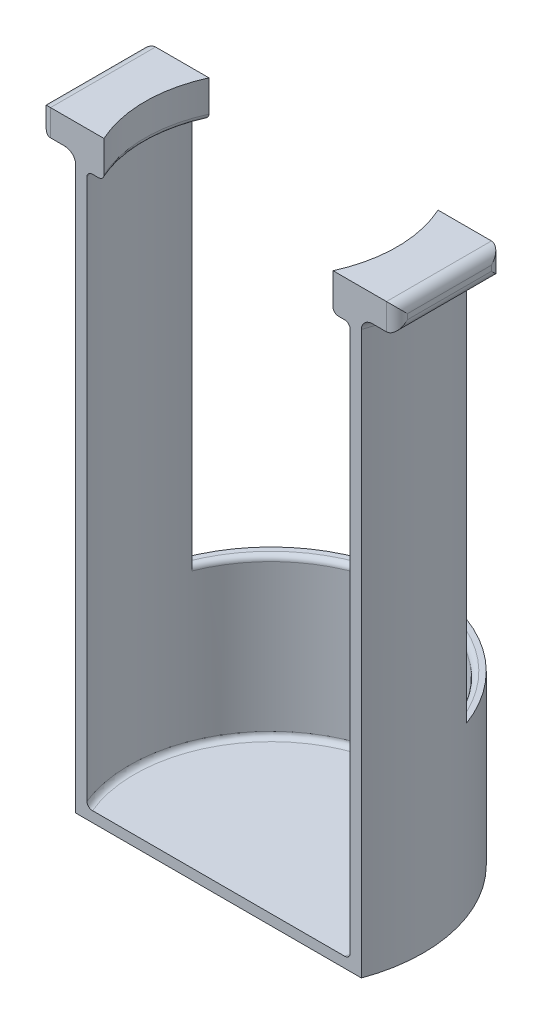
from build123d import *

# Parameters (mm, degrees)
SKETCH1_R           = 29
SKETCH1_R_2         = 27
BOSS_EXTRUDE1_DEPTH = 30
BOSS_EXTRUDE2_START = 2
SKETCH2_R           = 29
BOSS_EXTRUDE2_DEPTH = 2
BOSS_EXTRUDE3_DEPTH = 75
BOSS_EXTRUDE5_DEPTH = 2
FILLET2_R           = 1
BOSS_EXTRUDE6_DEPTH = 5
FILLET3_R           = 2
SKETCH7_W           = 70
SKETCH7_H           = 116
CUT_EXTRUDE1_DEPTH  = 19


with BuildPart() as part:
    # Sketch1 → Boss-Extrude1 (new body)
    with BuildSketch(Plane(origin=(0, 0, 0), x_dir=(1, 0, 0), z_dir=(0, 1, 0))):
        with Locations(Location((0, 0, 0), (0, 0, 270))):
            Circle(SKETCH1_R)
        with Locations(Location((0, 0, 0), (0, 0, 270))):
            Circle(SKETCH1_R_2, mode=Mode.SUBTRACT)
    extrude(amount=BOSS_EXTRUDE1_DEPTH)

    # Sketch2 → Boss-Extrude2 (add)
    with BuildSketch(Plane.XZ.offset(BOSS_EXTRUDE2_START)):
        with Locations(Location((0, 0, 0), (0, 0, 270))):
            Circle(SKETCH2_R)
    extrude(amount=-BOSS_EXTRUDE2_DEPTH)

    # Sketch3 → Boss-Extrude3 (add)
    with BuildSketch(Plane(origin=(0, 30, 0), x_dir=(1, 0, 0), z_dir=(0, 1, 0))):
        with BuildLine():
            ThreePointArc((27.221315178, -10), (29, 0), (27.221315178, 10))
            Line((27.221315178, 10), (25.079872408, 10))
            ThreePointArc((25.079872408, 10), (27, 0), (25.079872408, -10))
            Line((25.079872408, -10), (27.221315178, -10))
        make_face()
        with BuildLine():
            Line((-25.079872408, 10), (-27.221315178, 10))
            ThreePointArc((-27.221315178, 10), (-29, 0), (-27.221315178, -10))
            Line((-27.221315178, -10), (-25.079872408, -10))
            ThreePointArc((-25.079872408, -10), (-27, 0), (-25.079872408, 10))
        make_face()
    extrude(amount=BOSS_EXTRUDE3_DEPTH)

    # Sketch4 → Boss-Extrude5 (add)
    with BuildSketch(Plane(origin=(0, 105, 0), x_dir=(1, 0, 0), z_dir=(0, 1, 0))):
        with BuildLine():
            ThreePointArc((25.079872408, -10), (27, 0), (25.079872408, 10))
            Line((25.079872408, 10), (21.817424229, 10))
            ThreePointArc((21.817424229, 10), (23.448008247, 5.117705467), (24, 0))
            ThreePointArc((24, 0), (23.448008247, -5.117705467), (21.817424229, -10))
            Line((21.817424229, -10), (25.079872408, -10))
        make_face()
        with BuildLine():
            ThreePointArc((25.079872408, 10), (27, 0), (25.079872408, -10))
            Line((25.079872408, -10), (27.221315178, -10))
            ThreePointArc((27.221315178, -10), (29, 0), (27.221315178, 10))
            Line((27.221315178, 10), (25.079872408, 10))
        make_face()
        with BuildLine():
            Line((-21.817424229, 10), (-27.221315178, 10))
            ThreePointArc((-27.221315178, 10), (-28.551866312, 5.078477145), (-29, 3.9e-08))
            ThreePointArc((-29, 3.9e-08), (-28.551866318, -5.078477108), (-27.221315178, -10))
            Line((-27.221315178, -10), (-21.817424229, -10))
            ThreePointArc((-21.817424229, -10), (-24, 0), (-21.817424229, 10))
        make_face()
    extrude(amount=BOSS_EXTRUDE5_DEPTH)

    # Fillet2
    # the kernel refuses this fillet: 1 mm, written as the material it adds along each edge
    with BuildSketch(Plane(origin=(0, 105, 0), x_dir=(0.8906566474761322, 0, -0.4546765183144792), z_dir=(-0.4546765183144792, 0, -0.8906566474761322))) as fillet2_piece_1_section:
        with BuildLine():
            CenterArc((27 - FILLET2_R, FILLET2_R), FILLET2_R, 270, 90)
            Line((27 - FILLET2_R, 0), (27, 0))
            Line((27, 0), (27, FILLET2_R))
        make_face()
    fillet2_piece_1 = revolve(axis=Axis((0, 105, 0), (0, -1, 0)), revolution_arc=54.088245562, mode=Mode.PRIVATE)
    fillet2_piece_1 = split(fillet2_piece_1, bisect_by=Plane(origin=(26.719378233, 104.719378233, 10), z_dir=(0, 0, -1)), keep=Keep.TOP, mode=Mode.PRIVATE)
    fillet2_piece_1 = split(fillet2_piece_1, bisect_by=Plane(origin=(26.719378233, 104.719378233, -10), z_dir=(0, 0, 1)), keep=Keep.TOP, mode=Mode.PRIVATE)
    add(fillet2_piece_1)
    with BuildSketch(Plane(origin=(0, 105, 0), x_dir=(-0.890656647476122, 0, 0.4546765183144991), z_dir=(0.4546765183144991, 0, 0.890656647476122))) as fillet2_piece_2_section:
        with BuildLine():
            CenterArc((27 - FILLET2_R, FILLET2_R), FILLET2_R, 270, 90)
            Line((27 - FILLET2_R, 0), (27, 0))
            Line((27, 0), (27, FILLET2_R))
        make_face()
    fillet2_piece_2 = revolve(axis=Axis((0, 105, 0), (0, -1, 0)), revolution_arc=54.088245562, mode=Mode.PRIVATE)
    fillet2_piece_2 = split(fillet2_piece_2, bisect_by=Plane(origin=(-26.719378233, 104.719378233, 10), z_dir=(0, 0, -1)), keep=Keep.TOP, mode=Mode.PRIVATE)
    fillet2_piece_2 = split(fillet2_piece_2, bisect_by=Plane(origin=(-26.719378233, 104.719378233, -10), z_dir=(0, 0, 1)), keep=Keep.TOP, mode=Mode.PRIVATE)
    add(fillet2_piece_2)
    with BuildSketch(Plane(origin=(0, 0, 0), x_dir=(0, 0, 1), z_dir=(-1, 0, 0))) as fillet2_piece_3:
        with BuildLine():
            CenterArc((27 - FILLET2_R, FILLET2_R), FILLET2_R, 270, 90)
            Line((27 - FILLET2_R, 0), (27, 0))
            Line((27, 0), (27, FILLET2_R))
        make_face()
    revolve(axis=Axis((0, 0, 0), (0, 1, 0)))
    # the kernel refuses this fillet: 1 mm, written as the material it takes off along each edge
    with BuildSketch(Plane(origin=(0, 30, 0), x_dir=(0.9591739549871109, 0, -0.28281676766836794), z_dir=(0.28281676766836794, 0, 0.9591739549871109))) as fillet2_2_piece_1_section:
        with BuildLine():
            CenterArc((27 + FILLET2_R, -FILLET2_R), FILLET2_R, 90, 90)
            Line((27, -FILLET2_R), (27, 0))
            Line((27, 0), (27 + FILLET2_R, 0))
        make_face()
    fillet2_2_piece_1 = revolve(axis=Axis((0, 30, 0), (0, 1, 0)), revolution_arc=147.143219234, mode=Mode.PRIVATE)
    fillet2_2_piece_1 = split(fillet2_2_piece_1, bisect_by=Plane(origin=(0, 29.725140897, -10), z_dir=(0, 0, -1)), keep=Keep.TOP, mode=Mode.PRIVATE)
    add(fillet2_2_piece_1, mode=Mode.SUBTRACT)
    with BuildSketch(Plane(origin=(0, 30, 0), x_dir=(-0.9591557890892681, 0, 0.28287837007545047), z_dir=(-0.28287837007545047, 0, -0.9591557890892681))) as fillet2_2_piece_2_section:
        with BuildLine():
            CenterArc((27 + FILLET2_R, -FILLET2_R), FILLET2_R, 90, 90)
            Line((27, -FILLET2_R), (27, 0))
            Line((27, 0), (27 + FILLET2_R, 0))
        make_face()
    fillet2_2_piece_2 = revolve(axis=Axis((0, 30, 0), (0, 1, 0)), revolution_arc=73.567929793, mode=Mode.PRIVATE)
    fillet2_2_piece_2 = split(fillet2_2_piece_2, bisect_by=Plane(origin=(-15.465500951, 29.721420389, 10), z_dir=(0, 0, 1)), keep=Keep.TOP, mode=Mode.PRIVATE)
    add(fillet2_2_piece_2, mode=Mode.SUBTRACT)
    with BuildSketch(Plane(origin=(0, 105, 0), x_dir=(0.8608011340646036, 0, -0.5089414579232981), z_dir=(-0.5089414579232981, 0, -0.8608011340646036))) as fillet2_2_piece_3:
        with BuildLine():
            CenterArc((24 + FILLET2_R, -FILLET2_R), FILLET2_R, 90, 90)
            Line((24 + FILLET2_R, 0), (24, 0))
            Line((24, 0), (24, -FILLET2_R))
        make_face()
    revolve(axis=Axis((0, 105, 0), (0, -1, 0)), revolution_arc=61.186692958, mode=Mode.SUBTRACT)
    with BuildSketch(Plane(origin=(0, 105, 0), x_dir=(-0.860801134064602, 0, 0.5089414579233009), z_dir=(0.5089414579233009, 0, 0.860801134064602))) as fillet2_2_piece_4:
        with BuildLine():
            CenterArc((24 + FILLET2_R, -FILLET2_R), FILLET2_R, 90, 90)
            Line((24 + FILLET2_R, 0), (24, 0))
            Line((24, 0), (24, -FILLET2_R))
        make_face()
    revolve(axis=Axis((0, 105, 0), (0, -1, 0)), revolution_arc=61.186692958, mode=Mode.SUBTRACT)
    with BuildSketch(Plane(origin=(0, 30, 0), x_dir=(0, 0, 1), z_dir=(-1, 0, 0))) as fillet2_2_piece_5_section:
        with BuildLine():
            CenterArc((27 + FILLET2_R, -FILLET2_R), FILLET2_R, 90, 90)
            Line((27, -FILLET2_R), (27, 0))
            Line((27, 0), (27 + FILLET2_R, 0))
        make_face()
    fillet2_2_piece_5 = revolve(axis=Axis((0, 30, 0), (0, 1, 0)), revolution_arc=73.567929793, mode=Mode.PRIVATE)
    fillet2_2_piece_5 = split(fillet2_2_piece_5, bisect_by=Plane(origin=(15.465500935, 29.721420416, 10), z_dir=(0, 0, 1)), keep=Keep.TOP, mode=Mode.PRIVATE)
    add(fillet2_2_piece_5, mode=Mode.SUBTRACT)

    # Sketch6 → Boss-Extrude6 (add)
    with BuildSketch(Plane(origin=(0, 107, 0), x_dir=(1, 0, 0), z_dir=(0, 1, 0))):
        with BuildLine():
            ThreePointArc((-27.221315178, -10), (-29, 0), (-27.221315178, 10))
            Line((-27.221315178, 10), (-34, 10))
            Line((-34, 10), (-34, -10))
            Line((-34, -10), (-27.221315178, -10))
        make_face()
        with BuildLine():
            Line((-27.221315178, -10), (-21.817424229, -10))
            ThreePointArc((-21.817424229, -10), (-24, 0), (-21.817424229, 10))
            Line((-21.817424229, 10), (-27.221315178, 10))
            ThreePointArc((-27.221315178, 10), (-29, 0), (-27.221315178, -10))
        make_face()
        with BuildLine():
            Line((34, 10), (21.817424229, 10))
            ThreePointArc((21.817424229, 10), (23.448008247, 5.117705467), (24, 0))
            ThreePointArc((24, 0), (23.448008247, -5.117705467), (21.817424229, -10))
            Line((21.817424229, -10), (34, -10))
            Line((34, -10), (34, 10))
        make_face()
    extrude(amount=BOSS_EXTRUDE6_DEPTH)

    # Fillet3
    # the kernel refuses this fillet: 2 mm, written as the material it adds along each edge
    with BuildSketch(Plane(origin=(0, 107, 0), x_dir=(0.8655830504384638, 0, 0.5007653969611356), z_dir=(-0.5007653969611356, 0, 0.8655830504384638))) as fillet3_piece_1_section:
        with BuildLine():
            CenterArc((29 + FILLET3_R, -FILLET3_R), FILLET3_R, 90, 90)
            Line((29 + FILLET3_R, 0), (29, 0))
            Line((29, 0), (29, -FILLET3_R))
        make_face()
    fillet3_piece_1 = revolve(axis=Axis((0, 107, 0), (0, 1, 0)), revolution_arc=60.101302376, mode=Mode.PRIVATE)
    fillet3_piece_1 = split(fillet3_piece_1, bisect_by=Plane(origin=(29.566335582, 106.433664418, -10), z_dir=(0, 0, 1)), keep=Keep.TOP, mode=Mode.PRIVATE)
    fillet3_piece_1 = split(fillet3_piece_1, bisect_by=Plane(origin=(29.566335582, 106.433664418, 10), z_dir=(0, 0, -1)), keep=Keep.TOP, mode=Mode.PRIVATE)
    add(fillet3_piece_1)
    with BuildSketch(Plane(origin=(0, 107, 0), x_dir=(-0.8655830504384671, 0, 0.5007653969611302), z_dir=(0.5007653969611302, 0, 0.8655830504384671))) as fillet3_piece_2_section:
        with BuildLine():
            CenterArc((29 + FILLET3_R, FILLET3_R), FILLET3_R, 180, 90)
            Line((29 + FILLET3_R, 0), (29, 0))
            Line((29, 0), (29, FILLET3_R))
        make_face()
    fillet3_piece_2 = revolve(axis=Axis((0, 107, 0), (0, -1, 0)), revolution_arc=60.101302376, mode=Mode.PRIVATE)
    fillet3_piece_2 = split(fillet3_piece_2, bisect_by=Plane(origin=(-29.566335582, 106.433664418, 10), z_dir=(0, 0, -1)), keep=Keep.TOP, mode=Mode.PRIVATE)
    fillet3_piece_2 = split(fillet3_piece_2, bisect_by=Plane(origin=(-29.566335582, 106.433664418, -10), z_dir=(0, 0, 1)), keep=Keep.TOP, mode=Mode.PRIVATE)
    add(fillet3_piece_2)
    # the kernel refuses this fillet: 2 mm, written as the material it takes off along each edge
    with BuildSketch(Plane(origin=(-34, 107, -15), x_dir=(0, 1, 0), z_dir=(0, 0, 1)), Plane(origin=(34, 107, 15), x_dir=(0, 1, 0), z_dir=(0, 0, -1))) as fillet3_2_piece_1:
        with BuildLine():
            CenterArc((FILLET3_R, -FILLET3_R), FILLET3_R, 90, 90)
            Line((0, -FILLET3_R), (0, 0))
            Line((0, 0), (FILLET3_R, 0))
        make_face()
    extrude(amount=30, mode=Mode.SUBTRACT)
    with BuildSketch(Plane(origin=(-34, 102, -10), x_dir=(0, 0, 1), z_dir=(0, 1, 0)), Plane(origin=(-34, 102, 10), x_dir=(1, 0, 0), z_dir=(0, 1, 0)), Plane(origin=(34, 102, 10), x_dir=(0, 0, -1), z_dir=(0, 1, 0)), Plane(origin=(34, 102, -10), x_dir=(-1, 0, 0), z_dir=(0, 1, 0))) as fillet3_2_piece_2:
        with BuildLine():
            CenterArc((FILLET3_R, FILLET3_R), FILLET3_R, 180, 90)
            Line((0, FILLET3_R), (0, 0))
            Line((0, 0), (FILLET3_R, 0))
        make_face()
    extrude(amount=15, mode=Mode.SUBTRACT)
    with BuildSketch(Plane(origin=(-34, 112, -15), x_dir=(0, -1, 0), z_dir=(0, 0, 1)), Plane(origin=(34, 112, 15), x_dir=(0, -1, 0), z_dir=(0, 0, -1))) as fillet3_2_piece_3:
        with BuildLine():
            CenterArc((FILLET3_R, FILLET3_R), FILLET3_R, 180, 90)
            Line((0, FILLET3_R), (0, 0))
            Line((0, 0), (FILLET3_R, 0))
        make_face()
    extrude(amount=30, mode=Mode.SUBTRACT)

    # Sketch7 → Cut-Extrude1 (cut)
    with BuildSketch(Plane.XY.offset(29)):
        with Locations((0, 55)):
            Rectangle(SKETCH7_W, SKETCH7_H)
    extrude(amount=-CUT_EXTRUDE1_DEPTH, mode=Mode.SUBTRACT)


solid = part.part
